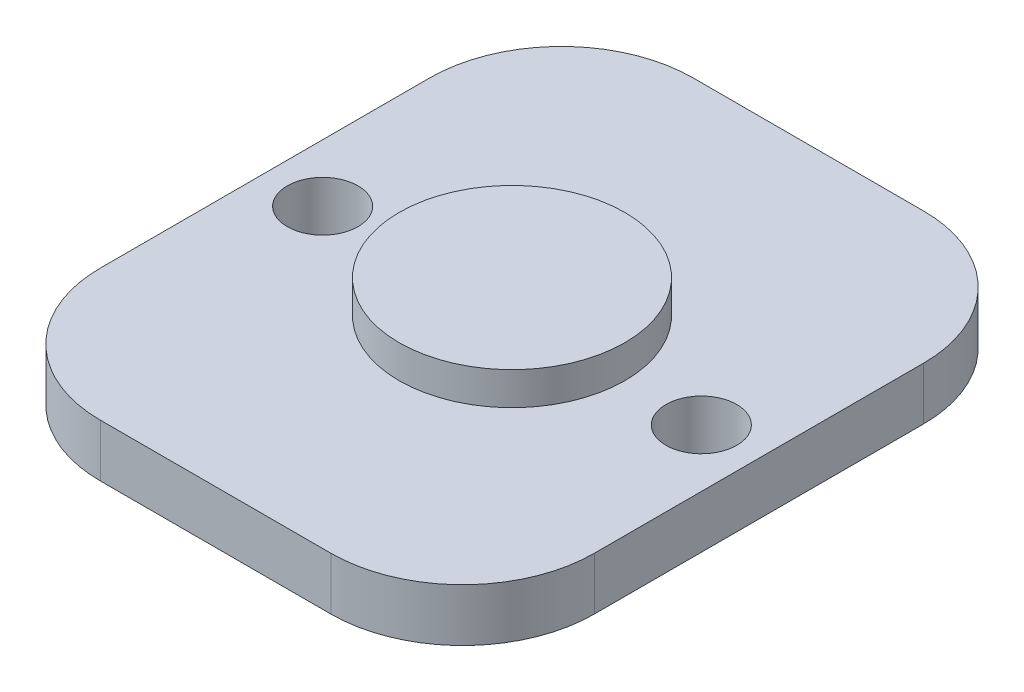
from build123d import *

# Parameters (mm, degrees)
SKETCH1_R           = 1.075
BOSS_EXTRUDE1_DEPTH = 1.6
SKETCH2_R           = 3.426475787
BOSS_EXTRUDE2_DEPTH = 1


with BuildPart() as part:
    # Sketch1 → Boss-Extrude1 (new body)
    with BuildSketch(Plane(origin=(0, 0, 0), x_dir=(1, 0, 0), z_dir=(0, 1, 0))):
        with BuildLine():
            Line((-3.5, 9), (3.5, 9))
            ThreePointArc((3.5, 9), (6.328427125, 7.828427125), (7.5, 5))
            Line((7.5, 5), (7.5, -5))
            ThreePointArc((7.5, -5), (6.328427125, -7.828427125), (3.5, -9))
            Line((3.5, -9), (-3.5, -9))
            ThreePointArc((-3.5, -9), (-6.328427125, -7.828427125), (-7.5, -5))
            Line((-7.5, -5), (-7.5, 5))
            ThreePointArc((-7.5, 5), (-6.328427125, 7.828427125), (-3.5, 9))
        make_face()
        with Locations((-5.75, 0)):
            Circle(SKETCH1_R, mode=Mode.SUBTRACT)
        with Locations((5.75, 0)):
            Circle(SKETCH1_R, mode=Mode.SUBTRACT)
    extrude(amount=BOSS_EXTRUDE1_DEPTH)

    # Sketch2 → Boss-Extrude2 (add)
    with BuildSketch(Plane(origin=(0, 1.6, 0), x_dir=(1, 0, 0), z_dir=(0, 1, 0))):
        Circle(SKETCH2_R)
    extrude(amount=BOSS_EXTRUDE2_DEPTH)


solid = part.part
